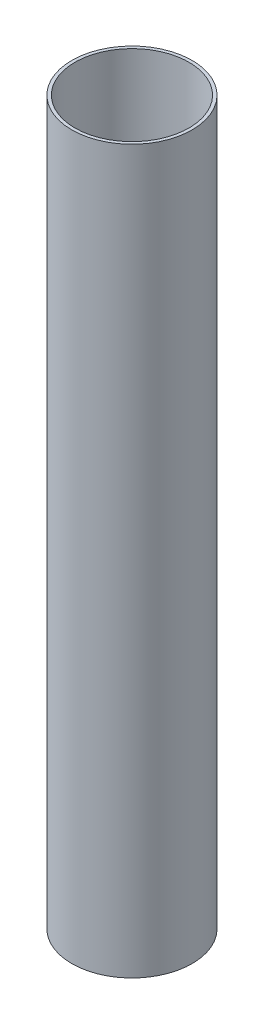
from build123d import *

# Parameters (mm, degrees)
SKETCH1_R           = 38.1
SKETCH1_R_2         = 36.1
BOSS_EXTRUDE1_DEPTH = 457.2


with BuildPart() as part:
    # Sketch1 → Boss-Extrude1 (new body)
    with BuildSketch(Plane(origin=(0, 0, 0), x_dir=(1, 0, 0), z_dir=(0, 1, 0))):
        Circle(SKETCH1_R)
        Circle(SKETCH1_R_2, mode=Mode.SUBTRACT)
    extrude(amount=BOSS_EXTRUDE1_DEPTH)


solid = part.part
